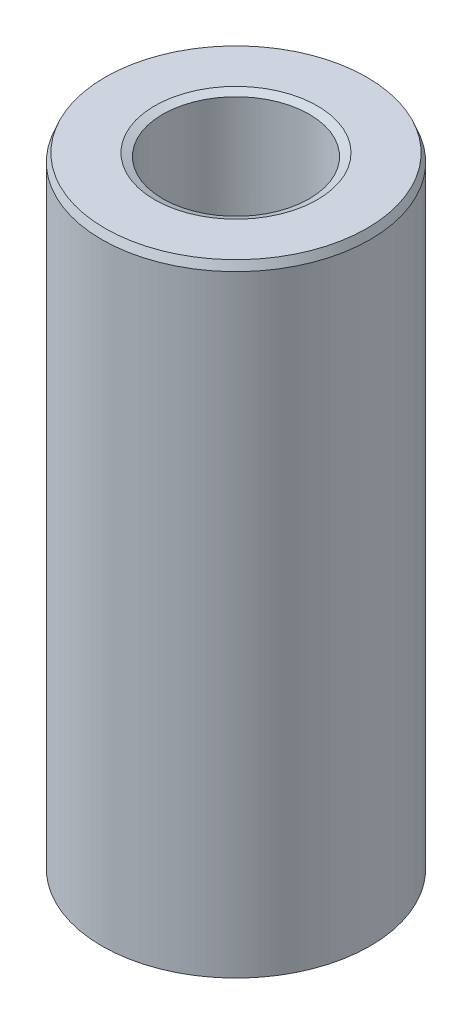
from build123d import *
from OCP.BRepFilletAPI import BRepFilletAPI_MakeChamfer

# Parameters (mm, degrees)
SKETCH1_R           = 12.5
BOSS_EXTRUDE1_DEPTH = 58.061024958
SKETCH2_R           = 6.82581279
CUT_EXTRUDE1_DEPTH  = 61.692525234
CHAMFER1_SIZE       = 0.755170871
CHAMFER1_SIZE2      = 0.300780208


with BuildPart() as part:
    # Sketch1 → Boss-Extrude1 (new body)
    with BuildSketch(Plane(origin=(0, 0, 0), x_dir=(1, 0, 0), z_dir=(0, 1, 0))):
        Circle(SKETCH1_R)
    extrude(amount=BOSS_EXTRUDE1_DEPTH)

    # Sketch2 → Cut-Extrude1 (cut, through all)
    with BuildSketch(Plane(origin=(0, 0, 0), x_dir=(1, 0, 0), z_dir=(0, 1, 0))):
        Circle(SKETCH2_R)
    extrude(amount=CUT_EXTRUDE1_DEPTH, mode=Mode.SUBTRACT)

    # Chamfer1: one chamfer whose edges measure the first distance from different faces: ONE call of the kernel's chamfer builder (chamfer() names one face for all edges)
    chamfer1_edges_1 = [part.edges().sort_by_distance(p)[0] for p in [
        (-6.82581279, 58.061024958, 0),
    ]]
    chamfer1_side_1 = [part.faces().sort_by_distance(p)[0] for p in [
        (-12.146446609, 58.061024958, 0),
    ]]
    chamfer1_edges_2 = [part.edges().sort_by_distance(p)[0] for p in [
        (-6.82581279, 0, 0),
    ]]
    chamfer1_side_2 = [part.faces().sort_by_distance(p)[0] for p in [
        (-6.82581279, 29.030512479, 0),
    ]]
    chamfer1_edges_3 = [part.edges().sort_by_distance(p)[0] for p in [
        (-12.5, 0, 0),
    ]]
    chamfer1_side_3 = [part.faces().sort_by_distance(p)[0] for p in [
        (-12.146446609, 0, 0),
    ]]
    chamfer1_edges_4 = [part.edges().sort_by_distance(p)[0] for p in [
        (-12.5, 58.061024958, 0),
    ]]
    chamfer1_side_4 = [part.faces().sort_by_distance(p)[0] for p in [
        (-12.5, 29.030512479, 0),
    ]]
    chamfer1 = BRepFilletAPI_MakeChamfer(part.part.solid().wrapped)
    for e in chamfer1_edges_1:
        chamfer1.Add(CHAMFER1_SIZE, CHAMFER1_SIZE2, e.wrapped, chamfer1_side_1[0].wrapped)  # the first distance lies on this face
    for e in chamfer1_edges_2:
        chamfer1.Add(CHAMFER1_SIZE, CHAMFER1_SIZE2, e.wrapped, chamfer1_side_2[0].wrapped)  # the first distance lies on this face
    for e in chamfer1_edges_3:
        chamfer1.Add(CHAMFER1_SIZE, CHAMFER1_SIZE2, e.wrapped, chamfer1_side_3[0].wrapped)  # the first distance lies on this face
    for e in chamfer1_edges_4:
        chamfer1.Add(CHAMFER1_SIZE, CHAMFER1_SIZE2, e.wrapped, chamfer1_side_4[0].wrapped)  # the first distance lies on this face
    add(Compound.cast(chamfer1.Shape()), mode=Mode.REPLACE)


solid = part.part
